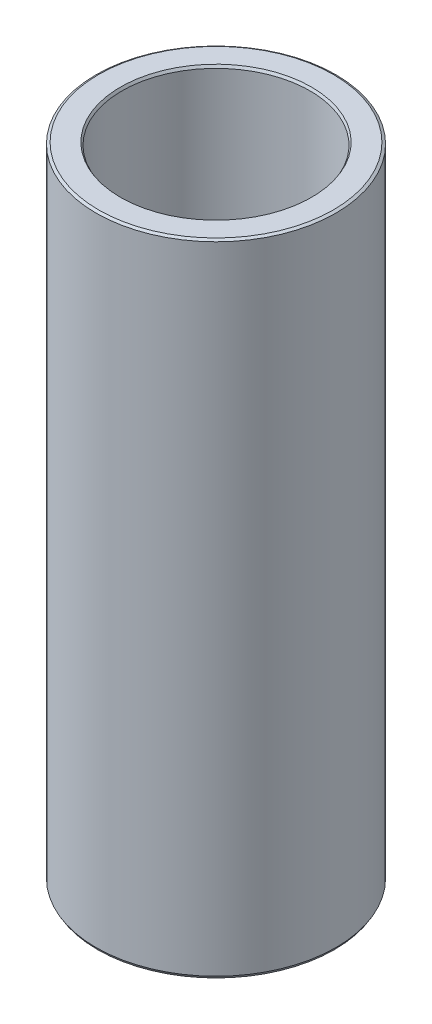
from build123d import *
from OCP.BRepFilletAPI import BRepFilletAPI_MakeChamfer

# Parameters (mm, degrees)
SKETCH1_R           = 60
BOSS_EXTRUDE1_DEPTH = 320.3008887
SKETCH2_R           = 47.079313193
CUT_EXTRUDE1_DEPTH  = 332.349753737
CHAMFER1_SIZE       = 0.739742714
CHAMFER1_SIZE2      = 1.281271965


with BuildPart() as part:
    # Sketch1 → Boss-Extrude1 (new body)
    with BuildSketch(Plane(origin=(0, 0, 0), x_dir=(1, 0, 0), z_dir=(0, 1, 0))):
        Circle(SKETCH1_R)
    extrude(amount=BOSS_EXTRUDE1_DEPTH)

    # Sketch2 → Cut-Extrude1 (cut, through all)
    with BuildSketch(Plane(origin=(0, 0, 0), x_dir=(1, 0, 0), z_dir=(0, 1, 0))):
        Circle(SKETCH2_R)
    extrude(amount=CUT_EXTRUDE1_DEPTH, mode=Mode.SUBTRACT)

    # Chamfer1: one chamfer whose edges measure the first distance from different faces: ONE call of the kernel's chamfer builder (chamfer() names one face for all edges)
    chamfer1_edges_1 = [part.edges().sort_by_distance(p)[0] for p in [
        (-47.079313193, 320.3008887, 0),
    ]]
    chamfer1_side_1 = [part.faces().sort_by_distance(p)[0] for p in [
        (-58.302943725, 320.3008887, 0),
    ]]
    chamfer1_edges_2 = [part.edges().sort_by_distance(p)[0] for p in [
        (-47.079313193, 0, 0),
    ]]
    chamfer1_side_2 = [part.faces().sort_by_distance(p)[0] for p in [
        (-47.079313193, 160.15044435, 0),
    ]]
    chamfer1_edges_3 = [part.edges().sort_by_distance(p)[0] for p in [
        (-60, 0, 0),
    ]]
    chamfer1_side_3 = [part.faces().sort_by_distance(p)[0] for p in [
        (-58.302943725, 0, 0),
    ]]
    chamfer1_edges_4 = [part.edges().sort_by_distance(p)[0] for p in [
        (-60, 320.3008887, 0),
    ]]
    chamfer1_side_4 = [part.faces().sort_by_distance(p)[0] for p in [
        (-60, 160.15044435, 0),
    ]]
    chamfer1 = BRepFilletAPI_MakeChamfer(part.part.solid().wrapped)
    for e in chamfer1_edges_1:
        chamfer1.Add(CHAMFER1_SIZE, CHAMFER1_SIZE2, e.wrapped, chamfer1_side_1[0].wrapped)  # the first distance lies on this face
    for e in chamfer1_edges_2:
        chamfer1.Add(CHAMFER1_SIZE, CHAMFER1_SIZE2, e.wrapped, chamfer1_side_2[0].wrapped)  # the first distance lies on this face
    for e in chamfer1_edges_3:
        chamfer1.Add(CHAMFER1_SIZE, CHAMFER1_SIZE2, e.wrapped, chamfer1_side_3[0].wrapped)  # the first distance lies on this face
    for e in chamfer1_edges_4:
        chamfer1.Add(CHAMFER1_SIZE, CHAMFER1_SIZE2, e.wrapped, chamfer1_side_4[0].wrapped)  # the first distance lies on this face
    add(Compound.cast(chamfer1.Shape()), mode=Mode.REPLACE)


solid = part.part
